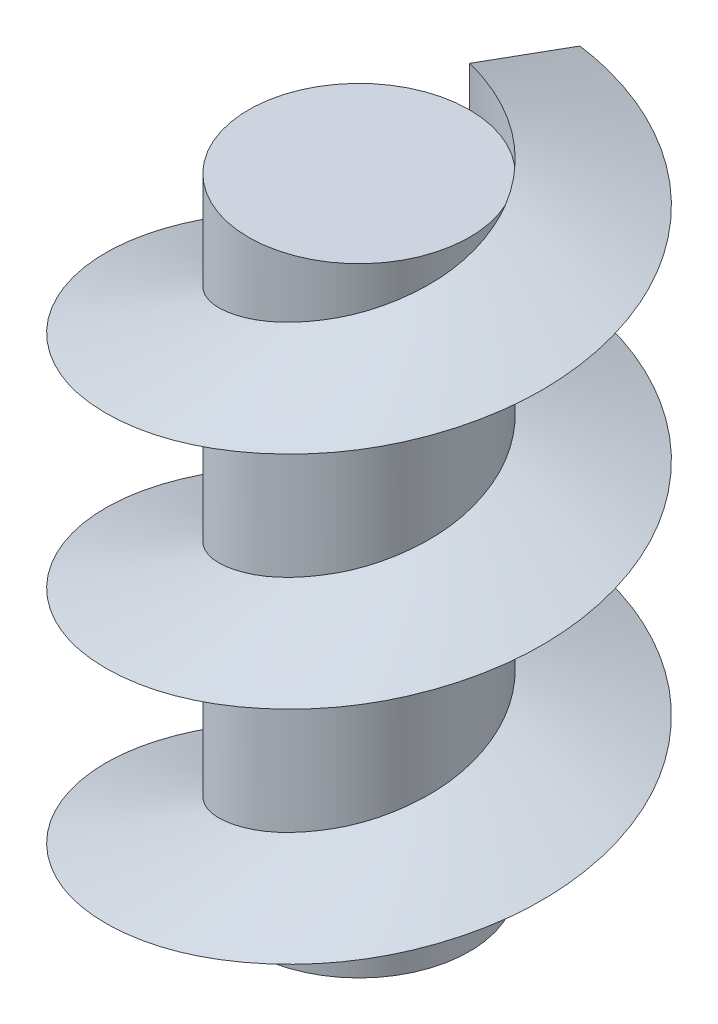
from build123d import *

# Parameters (mm, degrees)
ESQUISSE2_R           = 1.25
EXTRUSION1_DEPTH      = 10
BALAYAGE1_PITCH       = 2.5
EXTRUSION2_DEPTH      = 20.313652943
EXTRUSION2_DEPTH_BACK = 3
ESQUISSE5_R           = 3.615449726


with BuildPart() as part:
    # Esquisse2 → Extrusion1 (new body)
    with BuildSketch(Plane.XZ.offset(-4.657558322)):
        with Locations(Location((-0.389434894, -13.47998185, 0), (0, 0, 270))):
            Circle(ESQUISSE2_R)
    extrude(amount=EXTRUSION1_DEPTH)

    # Balayage1: the profile of Esquisse4 profile screwed along a right-hand helix of 4 turns, 10 arcs to a turn; built about Z, then put on its axis
    balayage1_z = Axis((0, 0, 0), (0, 0, 1))
    balayage1_corners = [(2.5, 0, 0), (1.2497, 0, 0.455071984), (1.2497, 0, -0.455071984)]
    with BuildLine(mode=Mode.PRIVATE) as balayage1_profile:
        Line(balayage1_corners[0], balayage1_corners[1])
        Line(balayage1_corners[1], balayage1_corners[2])
        Line(balayage1_corners[2], balayage1_corners[0])
    balayage1_cap = Face(balayage1_profile.wire())
    balayage1_turn_angles = [0, 18, 36, 54, 72, 90, 108, 126, 144, 162, 180, 198, 216, 234, 252, 270, 288, 306, 324, 342, 360]
    balayage1_turn_weights = [1, 0.9510565162951535, 1, 0.9510565162951535, 1, 0.9510565162951535, 1, 0.9510565162951535, 1, 0.9510565162951535, 1, 0.9510565162951535, 1, 0.9510565162951535, 1, 0.9510565162951535, 1, 0.9510565162951535, 1, 0.9510565162951535, 1]
    balayage1_turn_rails = [Edge.make_bspline([Vector(p[0], p[1], 0).rotate(balayage1_z, balayage1_turn_angles[k]) / balayage1_turn_weights[k] + Vector(0, 0, p[2] + BALAYAGE1_PITCH * balayage1_turn_angles[k] / 360) for k in range(21)], [0, 0, 0, 1, 1, 2, 2, 3, 3, 4, 4, 5, 5, 6, 6, 7, 7, 8, 8, 9, 9, 10, 10, 10], 2, balayage1_turn_weights) for p in balayage1_corners]
    balayage1_turn_sides = [Face.make_surface_from_curves(balayage1_turn_rails[p[0]], balayage1_turn_rails[p[1]]) for p in [(0, 1), (1, 2), (2, 0)]]
    balayage1 = Plane(origin=(-0.389434894, -5.342441678, -13.47998185), x_dir=(0, 0, -1), z_dir=(0, 1, 0)) * Solid(Shell([*[p.moved(Location((0, 0, BALAYAGE1_PITCH * i))) for i in range(4) for p in balayage1_turn_sides], balayage1_cap, balayage1_cap.rotate(balayage1_z, 1440).moved(Location((0, 0, BALAYAGE1_PITCH * 1440 / 360)))]))
    add(balayage1)

    # Esquisse5 → Extrusion2 (cut, two sides: drawn at the far end of the back side and taken through both)
    with BuildSketch(Plane.XZ.offset(5.342441678).offset(-EXTRUSION2_DEPTH_BACK)):
        with Locations((-0.389434894, -13.47998185)):
            Circle(ESQUISSE5_R)
    extrude(amount=EXTRUSION2_DEPTH + EXTRUSION2_DEPTH_BACK, mode=Mode.SUBTRACT)


solid = part.part
